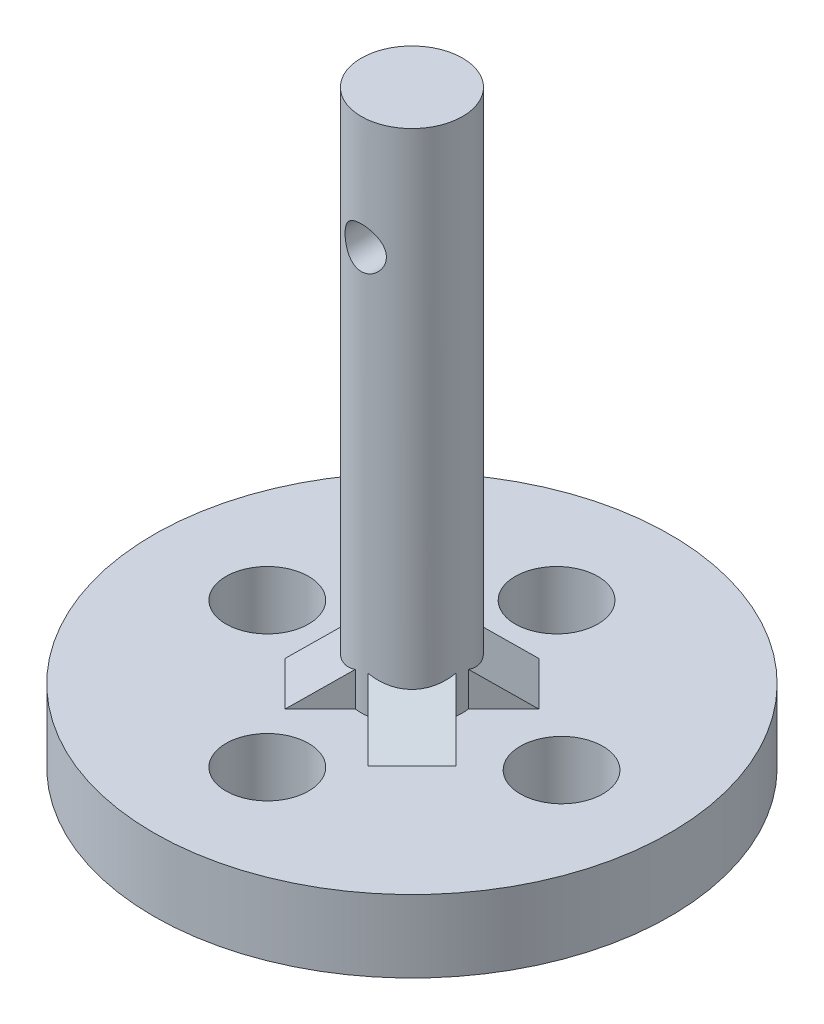
from build123d import *

# Parameters (mm, degrees)
SKETCH_1_R               = 12.5
EXTRUDE_1_DEPTH          = 3.5
SKETCH_2_R               = 2.45
EXTRUDE_2_DEPTH          = 25
SKETCH_4_R               = 2
CUT_EXTRUDE_1_DEPTH      = 31.618621785
SKETCH_4_5_R             = 2
CUT_EXTRUDE_2_DEPTH      = 31.618621785
RIB_1_REACH              = 35.537
SKETCH_8_WALL_W          = 74.969434882
SKETCH_8_WALL_H          = 3
RIB_6_REACH              = 35.537
SKETCH_9_WALL_W          = 75.07458535
SKETCH_9_WALL_H          = 3
RIB_7_REACH              = 35.537
SKETCH_11_WALL_W         = 75.144527038
SKETCH_11_WALL_H         = 3
CUT_EXTRUDE_4_DEPTH      = 30.008619409
CUT_EXTRUDE_4_DEPTH_BACK = 30.008619409
SKETCH_3D_7_R            = 1


with BuildPart() as part:
    # 草图1 → 凸台-拉伸1 (new body)
    with BuildSketch(Plane(origin=(0, 0, 0), x_dir=(1, 0, 0), z_dir=(0, 1, 0))):
        Circle(SKETCH_1_R)
    extrude(amount=EXTRUDE_1_DEPTH)

    # 草图2 → 凸台-拉伸2 (add)
    with BuildSketch(Plane(origin=(0, 3.5, 0), x_dir=(1, 0, 0), z_dir=(0, 1, 0))):
        Circle(SKETCH_2_R)
    extrude(amount=EXTRUDE_2_DEPTH)

    # 草图4 → 切除-拉伸1 (cut, through all)
    with BuildSketch(Plane(origin=(0, 3.5, 0), x_dir=(1, 0, 0), z_dir=(0, 1, 0))):
        with Locations((0, 7)):
            Circle(SKETCH_4_R)
    extrude(amount=-CUT_EXTRUDE_1_DEPTH, mode=Mode.SUBTRACT)

    # 草图4<5> → 切除-拉伸2 (cut, through all)
    with BuildSketch(Plane(origin=(0, 3.5, 0), x_dir=(1, 0, 0), z_dir=(0, 1, 0))):
        with Locations((7.241500052, 0)):
            Circle(SKETCH_4_5_R)
        with Locations((-7, 0)):
            Circle(SKETCH_4_5_R)
        with Locations((0, -7)):
            Circle(SKETCH_4_5_R)
    extrude(amount=-CUT_EXTRUDE_2_DEPTH, mode=Mode.SUBTRACT)

    # 草图8 wall → 筋1 (add, up to next)
    with BuildSketch(Plane(origin=(1.774725891, 4.95468166, 1.774725891), x_dir=(0.602127630795, -0.524294413919, 0.602127630795), z_dir=(0.37073213542, 0.85153706175, 0.37073213542)), mode=Mode.PRIVATE) as rib_1_sk1:
        Rectangle(SKETCH_8_WALL_W, SKETCH_8_WALL_H)
    rib_1_tool1 = extrude(rib_1_sk1.sketch, amount=-RIB_1_REACH, mode=Mode.PRIVATE) - part.part
    add(rib_1_tool1.solids().sort_by_distance((1.774725891, 4.95468166, 1.774725891))[0])

    # 草图9 wall → 筋6 (add, up to next)
    with BuildSketch(Plane(origin=(-1.825339457, 4.971513253, -1.825339457), x_dir=(-0.608446485545, -0.509495582371, -0.608446485545), z_dir=(0.360267781279, -0.860473271836, 0.360267781279)), mode=Mode.PRIVATE) as rib_6_sk1:
        Rectangle(SKETCH_9_WALL_W, SKETCH_9_WALL_H)
    rib_6_tool1 = extrude(rib_6_sk1.sketch, amount=RIB_6_REACH, mode=Mode.PRIVATE) - part.part
    add(rib_6_tool1.solids().sort_by_distance((-1.825339457, 4.971513253, -1.825339457))[0])

    # 草图11 wall → 筋7 (add, up to next)
    with BuildSketch(Plane(origin=(1.765395484, 4.77436806, -1.765395484), x_dir=(0.581684495472, -0.568582707664, -0.581684495472), z_dir=(0.402048688254, 0.822626102519, -0.402048688254)), mode=Mode.PRIVATE) as rib_7_sk1:
        Rectangle(SKETCH_11_WALL_W, SKETCH_11_WALL_H)
    rib_7_tool1 = extrude(rib_7_sk1.sketch, amount=-RIB_7_REACH, mode=Mode.PRIVATE) - part.part
    rib_7 = rib_7_tool1.solids().sort_by_distance((1.765395484, 4.77436806, -1.765395484))[0]
    add(rib_7)

    # 镜向1: 筋7 across plane
    add(rib_7.mirror(Plane(origin=(0, 0, 0), x_dir=(0.7071067811865465, 0, 0.7071067811865486), z_dir=(-0.7071067811865488, 0, 0.7071067811865464))))

    # Sketch 3D_7 → 切除-拉伸4 (cut, two sides: drawn at the far end of the back side and taken through both)
    with BuildSketch(Plane(origin=(0, 23, 0), x_dir=(0, 1, 0), z_dir=(0, 0, -1)).offset(-CUT_EXTRUDE_4_DEPTH_BACK)):
        Circle(SKETCH_3D_7_R)
    extrude(amount=CUT_EXTRUDE_4_DEPTH + CUT_EXTRUDE_4_DEPTH_BACK, mode=Mode.SUBTRACT)


solid = part.part
